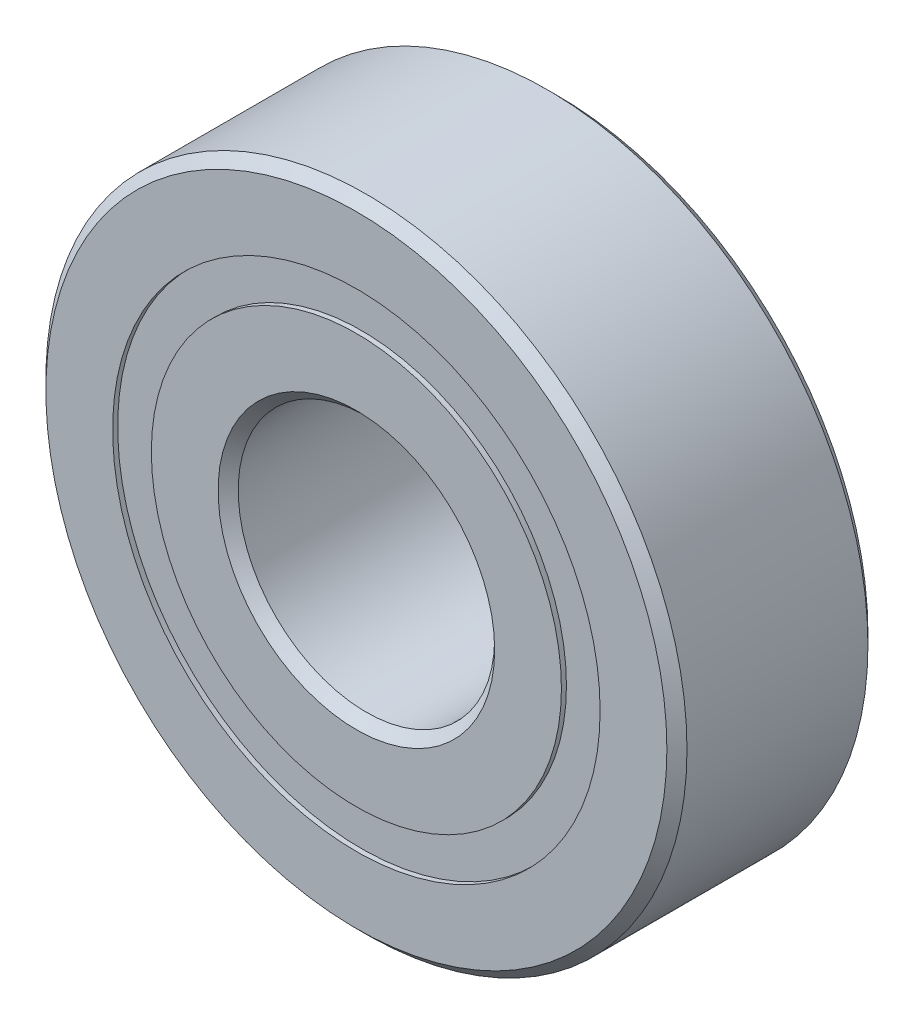
from build123d import *

# Parameters (mm, degrees)
CIRPATTERN1_COUNT = 8
SKETCH5_W         = 1.15919535
SKETCH5_H         = 0.957942858


with BuildPart() as part:
    # Sketch1 → Revolve1 (revolve)
    with BuildSketch(Plane(origin=(0, 0, 0), x_dir=(0, 0, -1), z_dir=(1, 0, 0))):
        with BuildLine():
            Line((2.24028, 7.9375), (-2.24028, 7.9375))
            Line((-2.24028, 7.9375), (-2.4892, 7.68858))
            Line((-2.4892, 7.68858), (-2.4892, 6.035221429))
            Line((-2.4892, 6.035221429), (-1.106311111, 6.035221429))
            ThreePointArc((-1.106311111, 6.035221429), (0, 6.76179465), (1.106311111, 6.035221429))
            Line((1.106311111, 6.035221429), (2.4892, 6.035221429))
            Line((2.4892, 6.035221429), (2.4892, 7.68858))
            Line((2.4892, 7.68858), (2.24028, 7.9375))
        make_face()
    revolve(axis=Axis((0, 0, 2.4892), (0, 0, -1)))


with BuildPart() as body_2:
    # Sketch3 → Revolve3 (revolve)
    with BuildSketch(Plane(origin=(0, 0, 0), x_dir=(0, 0, -1), z_dir=(1, 0, 0))):
        with BuildLine():
            Line((-2.4892, 5.077278571), (-1.106311111, 5.077278571))
            ThreePointArc((-1.106311111, 5.077278571), (0, 4.35070535), (1.106311111, 5.077278571))
            Line((1.106311111, 5.077278571), (2.4892, 5.077278571))
            Line((2.4892, 5.077278571), (2.4892, 3.42392))
            Line((2.4892, 3.42392), (2.24028, 3.175))
            Line((2.24028, 3.175), (-2.24028, 3.175))
            Line((-2.24028, 3.175), (-2.4892, 3.42392))
            Line((-2.4892, 3.42392), (-2.4892, 5.077278571))
        make_face()
    revolve(axis=Axis((0, 0, 2.4892), (0, 0, -1)))


with BuildPart() as body_3:
    # Sketch4 → Revolve4 (revolve)
    with BuildSketch(Plane(origin=(0, 0, 0), x_dir=(0, 0, -1), z_dir=(1, 0, 0))):
        with BuildLine():
            Line((-1.20554465, 5.55625), (1.20554465, 5.55625))
            ThreePointArc((1.20554465, 5.55625), (0, 6.76179465), (-1.20554465, 5.55625))
        make_face()
    revolve(axis=Axis((0, 5.55625, 1.20554465), (0, 0, -1)))


with BuildPart() as cirpattern1_1:
    # CirPattern1: pattern copy
    add(body_3.part.rotate(Axis((0, 0, -2.4892), (0, 0, 1)), 1 * 360 / CIRPATTERN1_COUNT))


with BuildPart() as cirpattern1_2:
    # CirPattern1: pattern copy
    add(body_3.part.rotate(Axis((0, 0, -2.4892), (0, 0, 1)), 2 * 360 / CIRPATTERN1_COUNT))


with BuildPart() as cirpattern1_3:
    # CirPattern1: pattern copy
    add(body_3.part.rotate(Axis((0, 0, -2.4892), (0, 0, 1)), 3 * 360 / CIRPATTERN1_COUNT))


with BuildPart() as cirpattern1_4:
    # CirPattern1: pattern copy
    add(body_3.part.rotate(Axis((0, 0, -2.4892), (0, 0, 1)), 4 * 360 / CIRPATTERN1_COUNT))


with BuildPart() as cirpattern1_5:
    # CirPattern1: pattern copy
    add(body_3.part.rotate(Axis((0, 0, -2.4892), (0, 0, 1)), 5 * 360 / CIRPATTERN1_COUNT))


with BuildPart() as cirpattern1_6:
    # CirPattern1: pattern copy
    add(body_3.part.rotate(Axis((0, 0, -2.4892), (0, 0, 1)), 6 * 360 / CIRPATTERN1_COUNT))


with BuildPart() as cirpattern1_7:
    # CirPattern1: pattern copy
    add(body_3.part.rotate(Axis((0, 0, -2.4892), (0, 0, 1)), 7 * 360 / CIRPATTERN1_COUNT))


with BuildPart() as body_11:
    # Sketch5 → Revolve5 (revolve)
    with BuildSketch(Plane(origin=(0, 0, 0), x_dir=(0, 0, -1), z_dir=(1, 0, 0))):
        with Locations((-1.785142325, 5.55625)):
            Rectangle(SKETCH5_W, SKETCH5_H)
        with Locations((1.785142325, 5.55625)):
            Rectangle(SKETCH5_W, SKETCH5_H)
    revolve(axis=Axis((0, 0, 2.4892), (0, 0, -1)))


solid = Compound([part.part, body_2.part, body_3.part, cirpattern1_1.part, cirpattern1_2.part, cirpattern1_3.part, cirpattern1_4.part, cirpattern1_5.part, cirpattern1_6.part, cirpattern1_7.part, body_11.part])
